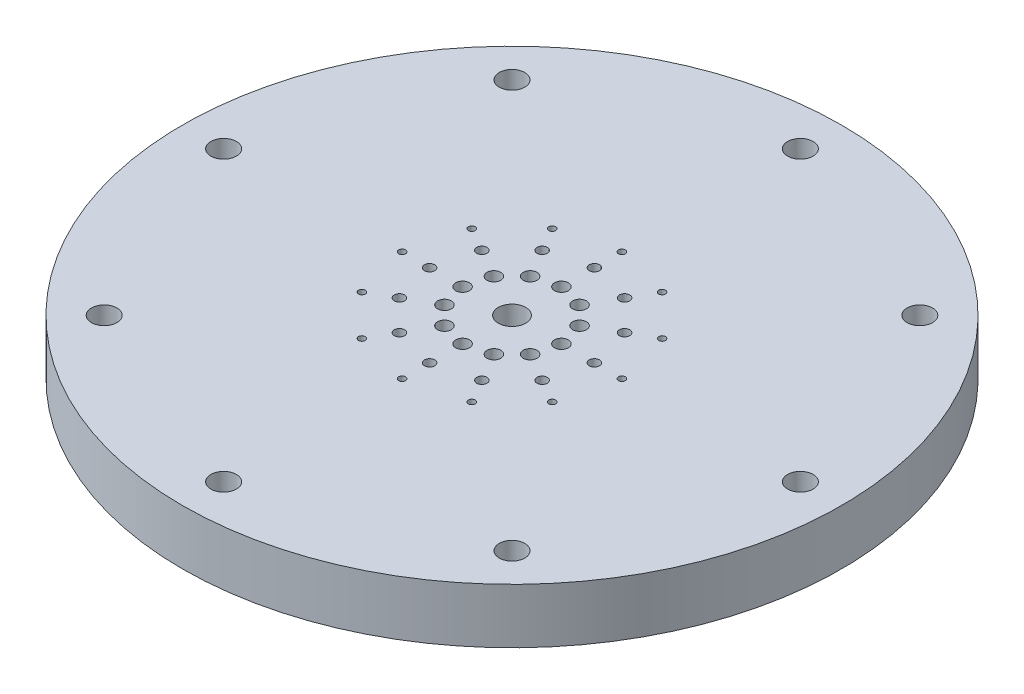
from build123d import *

# Parameters (mm, degrees)
SKETCH1_R                                      = 38.1
BOSS_EXTRUDE1_DEPTH                            = 6.35
CBORE_FOR_4_BUTTON_HEAD_CAP_SCREW1_D           = 2.9464
CBORE_FOR_4_BUTTON_HEAD_CAP_SCREW1_CBORE_D     = 4.826
CBORE_FOR_4_BUTTON_HEAD_CAP_SCREW1_CBORE_DEPTH = 2.8448
CIRPATTERN1_COUNT                              = 8
SKETCH7_R                                      = 0.3937
SKETCH7_R_2                                    = 0.5969
SKETCH7_R_3                                    = 0.8001
SKETCH7_R_4                                    = 1.5875
CUT_EXTRUDE1_DEPTH                             = 55.254423783
CIRPATTERN3_COUNT                              = 12


with BuildPart() as part:
    # Sketch1 → Boss-Extrude1 (new body)
    with BuildSketch(Plane(origin=(0, 0, 0), x_dir=(1, 0, 0), z_dir=(0, 1, 0))):
        Circle(SKETCH1_R)
    extrude(amount=BOSS_EXTRUDE1_DEPTH)

    # CBORE for #4 Button Head Cap Screw1 (through all)
    with Locations(Plane(origin=(0, 0, 0), x_dir=(-1, 0, 0), z_dir=(0, -1, 0))):
        with Locations((0, -33.3375)):
            cbore_for_4_button_head_cap_screw1 = CounterBoreHole(CBORE_FOR_4_BUTTON_HEAD_CAP_SCREW1_D / 2, CBORE_FOR_4_BUTTON_HEAD_CAP_SCREW1_CBORE_D / 2, CBORE_FOR_4_BUTTON_HEAD_CAP_SCREW1_CBORE_DEPTH)

    # CirPattern1: CBORE for #4 Button Head Cap Screw1 ×8 about axis
    cirpattern1_axis = Axis((0, 0, 0), (0, 1, 0))
    for i in range(1, CIRPATTERN1_COUNT):
        add(cbore_for_4_button_head_cap_screw1.rotate(cirpattern1_axis, i * 360 / CIRPATTERN1_COUNT), mode=Mode.SUBTRACT)

    # Sketch7 → Cut-Extrude1 (cut, through all)
    with BuildSketch(Plane.XZ):
        with Locations((0, 12.7)):
            Circle(SKETCH7_R)
        with Locations((0, 9.525)):
            Circle(SKETCH7_R_2)
        with Locations((0, 5.715)):
            Circle(SKETCH7_R_3)
        Circle(SKETCH7_R_4)
    cut_extrude1 = extrude(amount=-CUT_EXTRUDE1_DEPTH, mode=Mode.SUBTRACT)

    # CirPattern3: Cut-Extrude1 ×12 about axis
    cirpattern3_axis = Axis((0, 0, 0), (0, 1, 0))
    for i in range(1, CIRPATTERN3_COUNT):
        add(cut_extrude1.rotate(cirpattern3_axis, i * 360 / CIRPATTERN3_COUNT), mode=Mode.SUBTRACT)


solid = part.part
